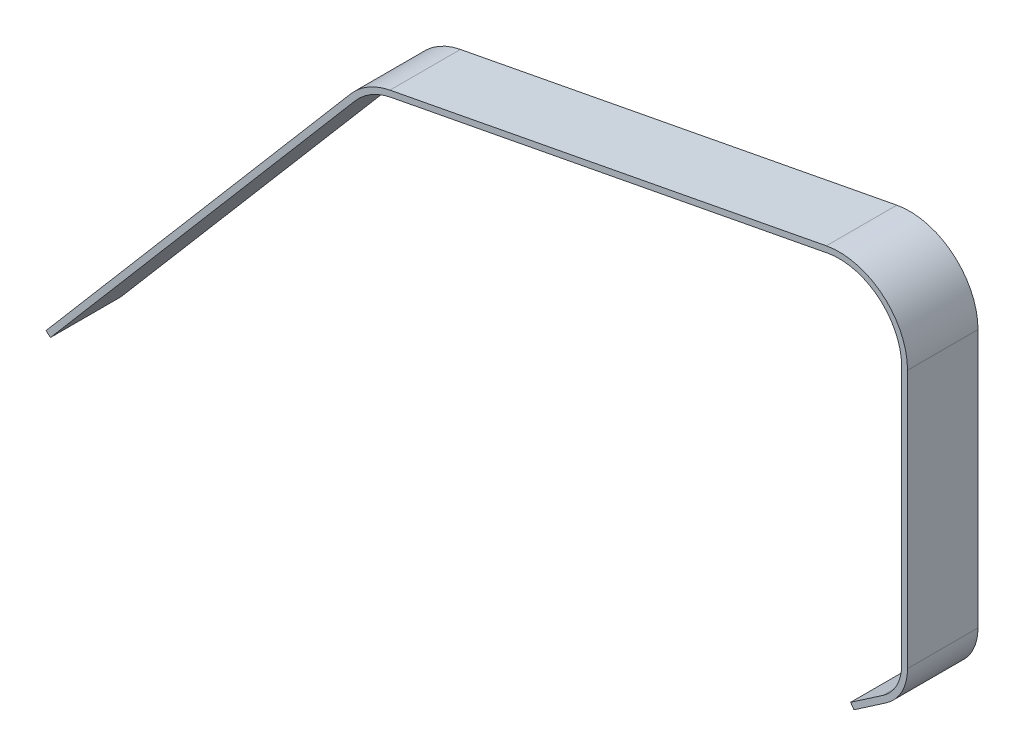
from build123d import *

# Parameters (mm, degrees)
BOSS_EXTRUDE1_DEPTH = 38.1


with BuildPart() as part:
    # Sketch1 → Boss-Extrude1 (new body)
    with BuildSketch(Plane.XY):
        with BuildLine():
            Line((229.052656436, 81.384103362), (-6.935300935, 36.310776905))
            ThreePointArc((-6.935300935, 36.310776905), (-18.583880119, 31.956381494), (-28.129385158, 23.985591698))
            Line((-28.129385158, 23.985591698), (-192.93350566, -169.290381629))
            Line((-192.93350566, -169.290381629), (-190.517555994, -171.350433135))
            Line((-190.517555994, -171.350433135), (-25.664970164, 21.982279285))
            ThreePointArc((-25.664970164, 21.982279285), (-16.955511393, 29.230496566), (-6.339651839, 33.192169418))
            Line((-6.339651839, 33.192169418), (229.648305532, 78.265495875))
            ThreePointArc((229.648305532, 78.265495875), (257.524909947, 71.113122345), (269.780135403, 45.073326458))
            Line((269.780135403, 45.073326458), (269.780135403, -94.657538302))
            ThreePointArc((269.780135403, -94.657538302), (267.098462035, -105.495350324), (259.672294138, -113.832110596))
            Line((259.672294138, -113.832110596), (242.180729463, -125.812534038))
            Line((242.180729463, -125.812534038), (243.974876831, -128.432011128))
            Line((243.974876831, -128.432011128), (261.466441506, -116.451587685))
            ThreePointArc((261.466441506, -116.451587685), (269.914305701, -106.962271924), (272.955117371, -94.626673542))
            Line((272.955117371, -94.626673542), (272.955117371, 45.073326458))
            ThreePointArc((272.955117371, 45.073326458), (259.548438469, 73.559720559), (229.052656436, 81.384103362))
        make_face()
    extrude(amount=BOSS_EXTRUDE1_DEPTH)


solid = part.part
